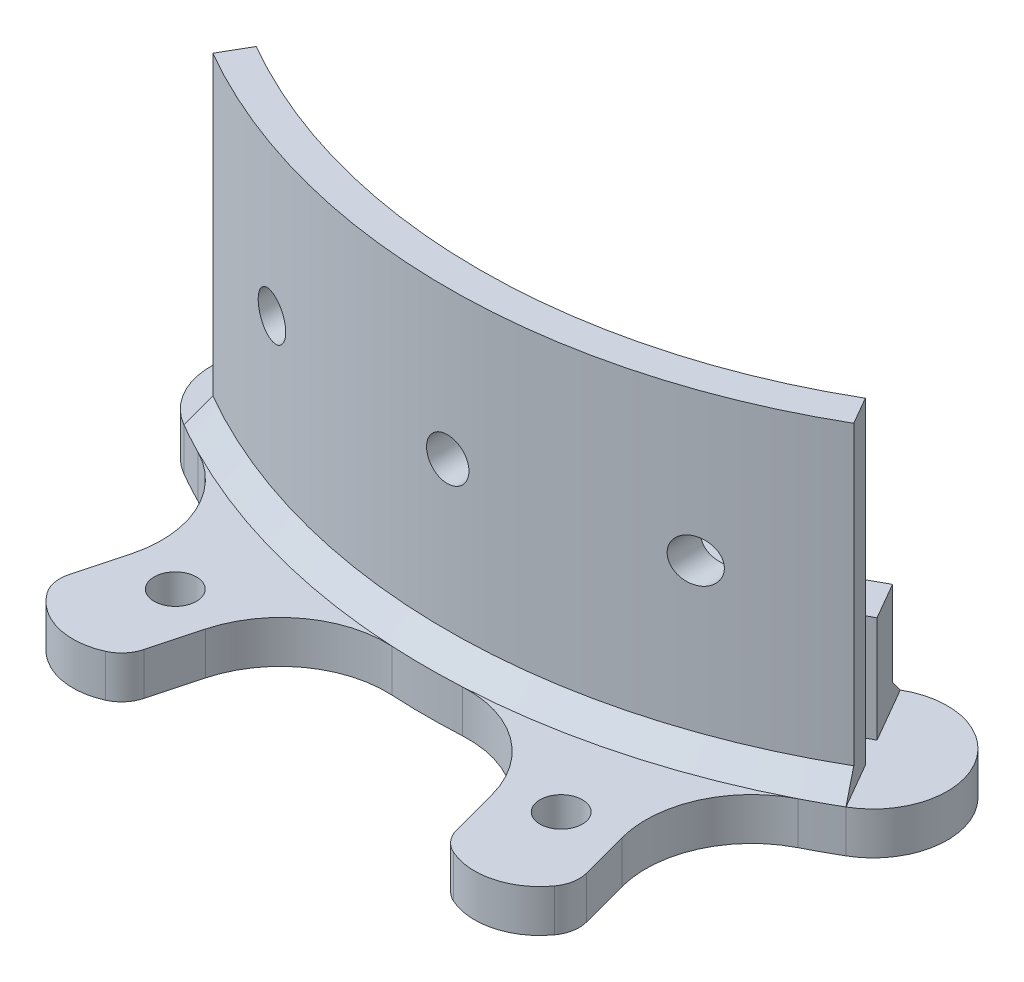
from build123d import *

# Parameters (mm, degrees)
BOSS_EXTRUDE1_DEPTH     = 10
BOSS_EXTRUDE2_DEPTH     = 30
BOSS_EXTRUDE3_DEPTH     = 4
CHAMFER1_SIZE           = 2
CUT_EXTRUDE1_DEPTH      = 78.548774974
CUT_EXTRUDE1_DEPTH_BACK = 78.548774974
SKETCH5_R               = 2
BOSS_EXTRUDE4_START     = -4
SKETCH6_R               = 2
BOSS_EXTRUDE4_DEPTH     = 4
FILLET1_R               = 10


with BuildPart() as part:
    # Sketch1 → Boss-Extrude1 (new body)
    with BuildSketch(Plane(origin=(0, 0, 0), x_dir=(1, 0, 0), z_dir=(0, 1, 0))):
        with BuildLine():
            ThreePointArc((-25.25, -43.734282891), (0, -50.5), (25.25, -43.734282891))
            Line((25.25, -43.734282891), (27.25, -47.198384506))
            ThreePointArc((27.25, -47.198384506), (0, -54.5), (-27.25, -47.198384506))
            Line((-27.25, -47.198384506), (-25.25, -43.734282891))
        make_face()
    extrude(amount=BOSS_EXTRUDE1_DEPTH)



with BuildPart() as body_2:
    # Sketch3 → Boss-Extrude2 (new body)
    with BuildSketch(Plane.XZ):
        with BuildLine():
            Line((-30.25, 52.394536929), (-28.75, 49.796460718))
            ThreePointArc((-28.75, 49.796460718), (0, 57.5), (28.75, 49.796460718))
            Line((28.75, 49.796460718), (30.25, 52.394536929))
            ThreePointArc((30.25, 52.394536929), (0, 60.5), (-30.25, 52.394536929))
        make_face()
    extrude(amount=-BOSS_EXTRUDE2_DEPTH)


with BuildPart() as part_1:
    add(part.part)

    add(body_2.part)  # Boss-Extrude3 merges body 2
    # Sketch4 → Boss-Extrude3 (add)
    with BuildSketch(Plane.XZ):
        with BuildLine():
            ThreePointArc((-24.25, 42.002232084), (0, 48.5), (24.25, 42.002232084))
            ThreePointArc((24.25, 42.002232084), (33.812177826, 44.56440991), (31.25, 54.126587737))
            ThreePointArc((31.25, 54.126587737), (0, 62.5), (-31.25, 54.126587737))
            ThreePointArc((-31.25, 54.126587737), (-33.812177826, 44.56440991), (-24.25, 42.002232084))
        make_face()
    extrude(amount=BOSS_EXTRUDE3_DEPTH)

    # Chamfer1
    chamfer1_edges = [part_1.edges().sort_by_distance(p)[0] for p in [
        (0, 0, 60.5),
        (0, 0, 50.5),
    ]]
    chamfer(chamfer1_edges, length=CHAMFER1_SIZE - 0.0001)  # a hair under: the kernel refuses the full size

    # Sketch5 → Cut-Extrude1 (cut, two sides: drawn at the far end of the back side and taken through both)
    with BuildSketch(Plane.XY.offset(-CUT_EXTRUDE1_DEPTH_BACK)):
        with Locations(Location((0, 16, 0), (0, 0, 180))):
            Circle(SKETCH5_R)
        with Locations(Location((-20, 16, 0), (0, 0, 180))):
            Circle(SKETCH5_R)
        with Locations(Location((20, 16, 0), (0, 0, 180))):
            Circle(SKETCH5_R)
    extrude(amount=CUT_EXTRUDE1_DEPTH + CUT_EXTRUDE1_DEPTH_BACK, mode=Mode.SUBTRACT)

    # Sketch6 → Boss-Extrude4 (add)
    # profile 1 of 2: a face of its own
    with BuildSketch(Plane.XZ.offset(4).offset(BOSS_EXTRUDE4_START)):
        with BuildLine():
            Line((20.953972553, 58.882773663), (24.414654978, 71.798216302))
            ThreePointArc((24.414654978, 71.798216302), (24.468385119, 73.111891055), (23.955219754, 74.322382523))
            ThreePointArc((23.955219754, 74.322382523), (20.546663808, 76.681193258), (16.415362401, 76.342681212))
            ThreePointArc((16.415362401, 76.342681212), (15.365702425, 75.550947532), (14.755396715, 74.386406753))
            Line((14.755396715, 74.386406753), (11.29471429, 61.470964114))
            ThreePointArc((11.29471429, 61.470964114), (16.176190319, 60.370364143), (20.953972553, 58.882773663))
        make_face()
        with Locations(Location((18.213190451, 67.972552131, 0), (0, 0, 270))):
            Circle(SKETCH6_R, mode=Mode.SUBTRACT)
    # profile 2 of 2: a face of its own
    with BuildSketch(Plane.XZ.offset(4).offset(BOSS_EXTRUDE4_START)):
        with BuildLine():
            Line((-20.953972553, 58.882773663), (-24.414654978, 71.798216302))
            ThreePointArc((-24.414654978, 71.798216302), (-24.468385119, 73.111891055), (-23.955219754, 74.322382523))
            ThreePointArc((-23.955219754, 74.322382523), (-20.546663808, 76.681193258), (-16.415362401, 76.342681212))
            ThreePointArc((-16.415362401, 76.342681212), (-15.365702425, 75.550947532), (-14.755396715, 74.386406753))
            Line((-14.755396715, 74.386406753), (-11.29471429, 61.470964114))
            ThreePointArc((-11.29471429, 61.470964114), (-16.176190319, 60.370364143), (-20.953972553, 58.882773663))
        make_face()
        with Locations(Location((-18.213190451, 67.972552131, 0), (0, 0, 270))):
            Circle(SKETCH6_R, mode=Mode.SUBTRACT)
    extrude(amount=BOSS_EXTRUDE4_DEPTH)

    # Fillet1
    fillet1_edges = [part_1.edges().sort_by_distance(p)[0] for p in [
        (-11.29471429, -2, 61.470964114),
        (-20.953972553, -2, 58.882773663),
        (20.953972553, -2, 58.882773663),
        (11.29471429, -2, 61.470964114),
    ]]
    fillet(fillet1_edges, radius=FILLET1_R)


solid = part_1.part
